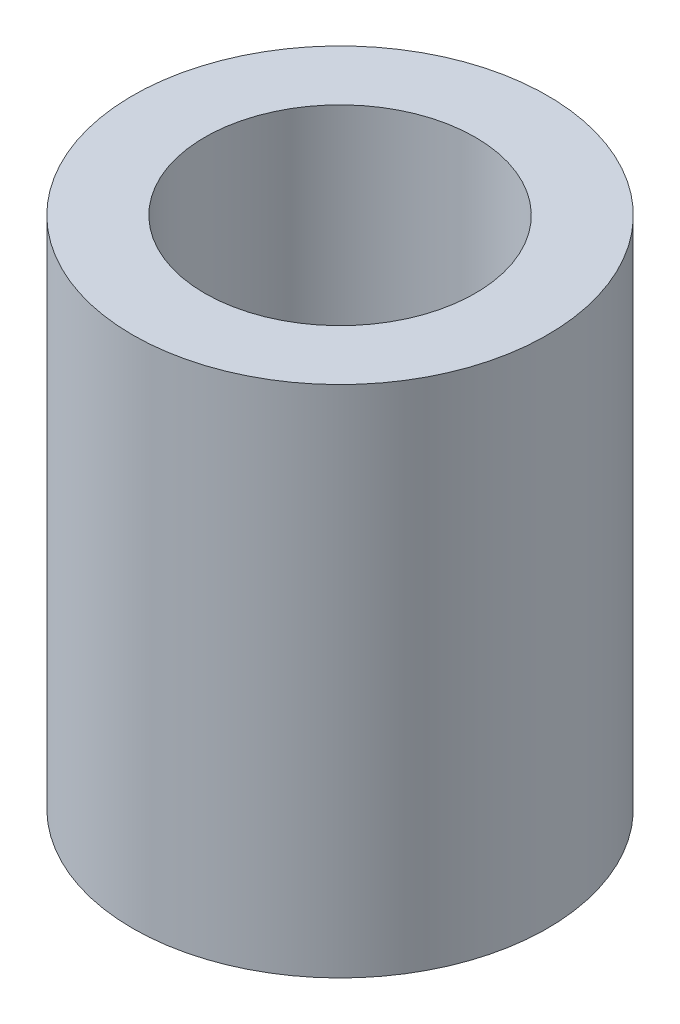
from build123d import *

# Parameters (mm, degrees)
SKETCH1_R           = 2.3
SKETCH1_R_2         = 1.5
BOSS_EXTRUDE1_DEPTH = 5.7


with BuildPart() as part:
    # Sketch1 → Boss-Extrude1 (new body)
    with BuildSketch(Plane(origin=(0, 0, 0), x_dir=(1, 0, 0), z_dir=(0, 1, 0))):
        Circle(SKETCH1_R)
        Circle(SKETCH1_R_2, mode=Mode.SUBTRACT)
    extrude(amount=BOSS_EXTRUDE1_DEPTH)


solid = part.part
